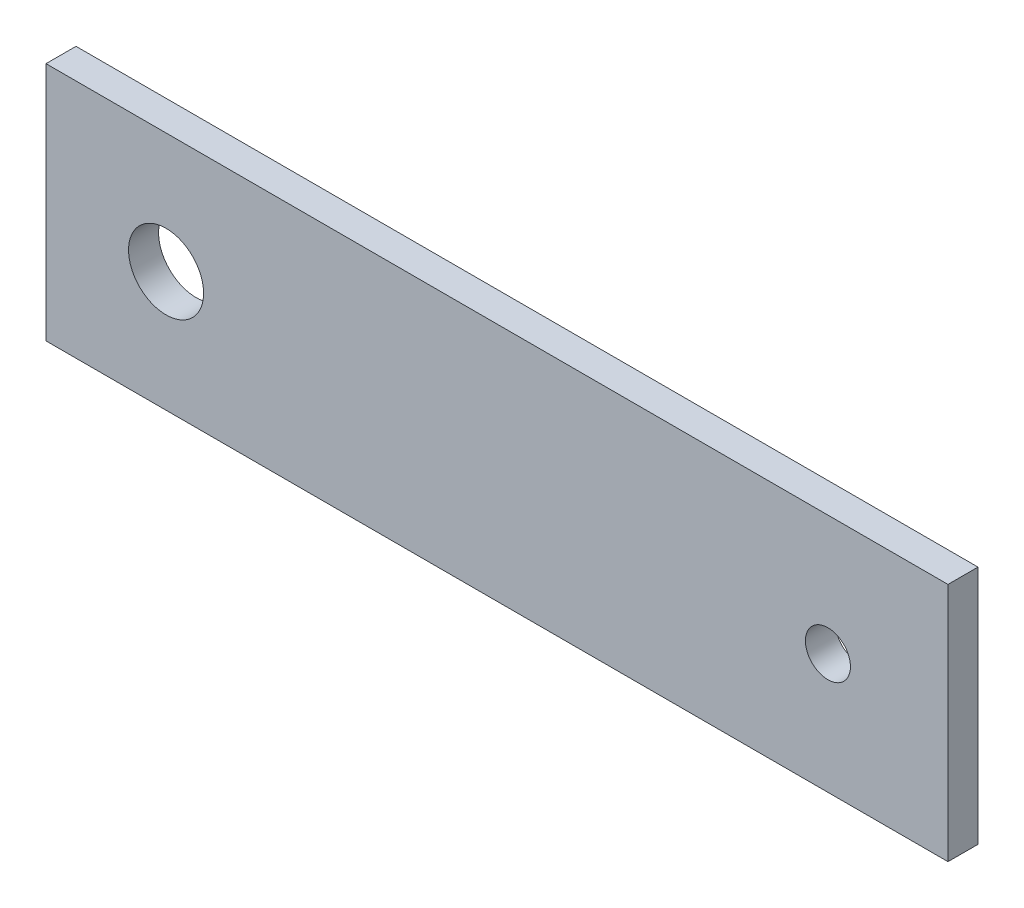
from build123d import *

# Parameters (mm, degrees)
SKETCH_1_W      = 120.2
SKETCH_1_H      = 32
SKETCH_1_R      = 5
SKETCH_1_R_2    = 3
EXTRUDE_1_DEPTH = 2


with BuildPart() as part:
    # 草图1 → 凸台-拉伸1 (new, symmetric)
    with BuildSketch(Plane.XY):
        with Locations((44.1, 0)):
            Rectangle(SKETCH_1_W, SKETCH_1_H)
        Circle(SKETCH_1_R, mode=Mode.SUBTRACT)
        with Locations((88.2, 0)):
            Circle(SKETCH_1_R_2, mode=Mode.SUBTRACT)
    extrude(amount=EXTRUDE_1_DEPTH, both=True)


solid = part.part
